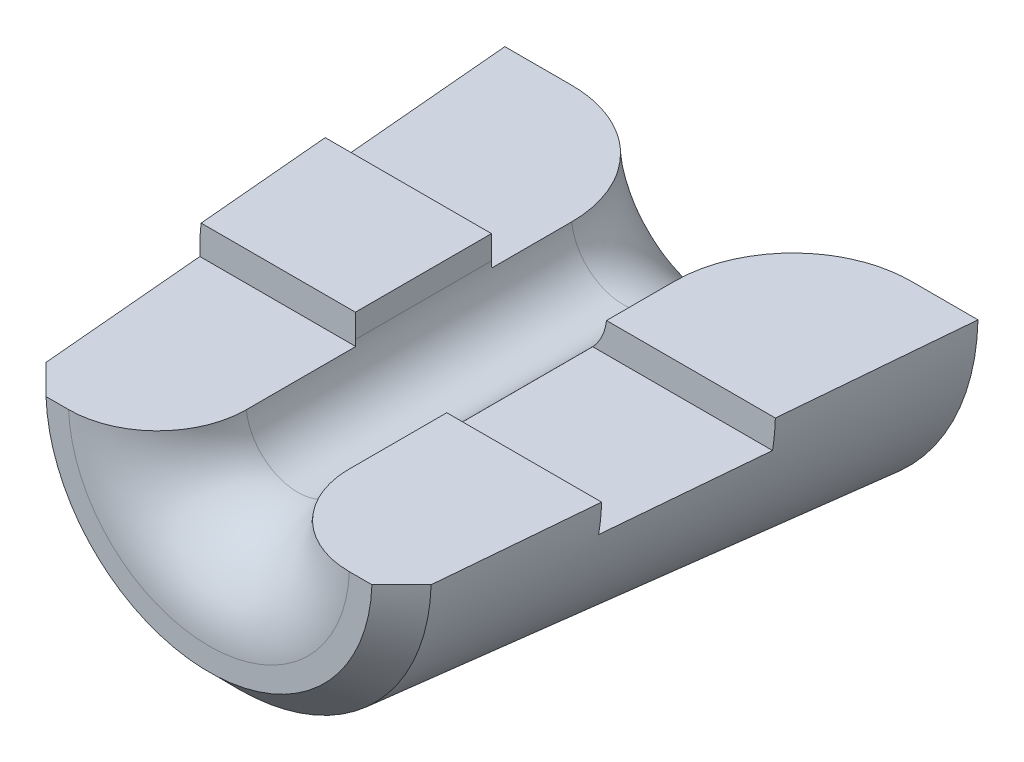
from build123d import *

# Parameters (mm, degrees)
SKETCH3_R               = 1.75
WIRE_HOLE_CUT_DEPTH     = 22.260291625
FRONT_STRAIN_FILLET_R   = 3
REAR_STRAIN_FILLET_R    = 4
SPLIT_CUT_1_DEPTH       = 22.260291625
SPLIT_CUT_2_DEPTH       = 22.26029171
WIRE_INSERT_NOTCH_DEPTH = 22.259351006


with BuildPart() as part:
    # Sketch2 → Body Revolve1 (revolve)
    with BuildSketch(Plane(origin=(0, 0, 0), x_dir=(0, 0, -1), z_dir=(1, 0, 0))):
        Polygon((0, 0), (-18, 0), (-18, 5.51269272), (-17, 6.51269272), (0, 8), align=None)
    revolve(axis=Axis((0, 0, 18), (0, 0, 1)))

    # Sketch3 → Wire Hole Cut (cut, through all)
    with BuildSketch(Plane.XY):
        Circle(SKETCH3_R)
    extrude(amount=WIRE_HOLE_CUT_DEPTH, mode=Mode.SUBTRACT)

    # Front Strain Fillet
    front_strain_fillet_edges = [part.edges().sort_by_distance(p)[0] for p in [
        (-1.75, 0, 18),
    ]]
    fillet(front_strain_fillet_edges, radius=FRONT_STRAIN_FILLET_R)

    # Rear Strain Fillet
    rear_strain_fillet_edges = [part.edges().sort_by_distance(p)[0] for p in [
        (-1.75, 0, 0),
    ]]
    fillet(rear_strain_fillet_edges, radius=REAR_STRAIN_FILLET_R)

    # Sketch5 → Split Cut 1 (cut, through all)
    with BuildSketch(Plane(origin=(0, 0, 0), x_dir=(0, 0, -1), z_dir=(1, 0, 0))):
        Polygon((-18, 0), (-11.5, 0), (-11.5, 1), (-6.5, 1), (-6.5, 0), (0, 0), (0, -0.2), (-6.7, -0.2), (-6.7, 0.8), (-11.3, 0.8), (-11.3, -0.2), (-18, -0.2), align=None)
    extrude(amount=-SPLIT_CUT_1_DEPTH, mode=Mode.SUBTRACT)

    # Sketch7 → Split Cut 2 (cut, through all)
    with BuildSketch(Plane(origin=(0, 0, 0), x_dir=(0, 0, -1), z_dir=(1, 0, 0))):
        Polygon((-18, 0), (-11.5, 0), (-11.5, -1), (-6.5, -1), (-6.5, 0), (0, 0), (0, -0.2), (-6.3, -0.2), (-6.3, -1.2), (-11.7, -1.2), (-11.7, -0.2), (-18, -0.2), align=None)
    extrude(amount=SPLIT_CUT_2_DEPTH, mode=Mode.SUBTRACT)


with BuildPart() as body_2:
    # of the pieces the cut leaves, the one that is kept (split_cut_2_keep)
    add(part.part.solids().sort_by_distance((-1.738533865, -0.2, 4))[0])

    # Sketch6 → Wire Insert Notch (cut, through all)
    with BuildSketch(Plane.XY):
        with BuildLine():
            Line((-1.75, 0), (-1.75, 2))
            Line((-1.75, 2), (1.75, 2))
            Line((1.75, 2), (1.75, 0))
            ThreePointArc((1.75, 0), (0, -1.75), (-1.75, 0))
        make_face()
    extrude(amount=WIRE_INSERT_NOTCH_DEPTH, mode=Mode.SUBTRACT)


solid = body_2.part
